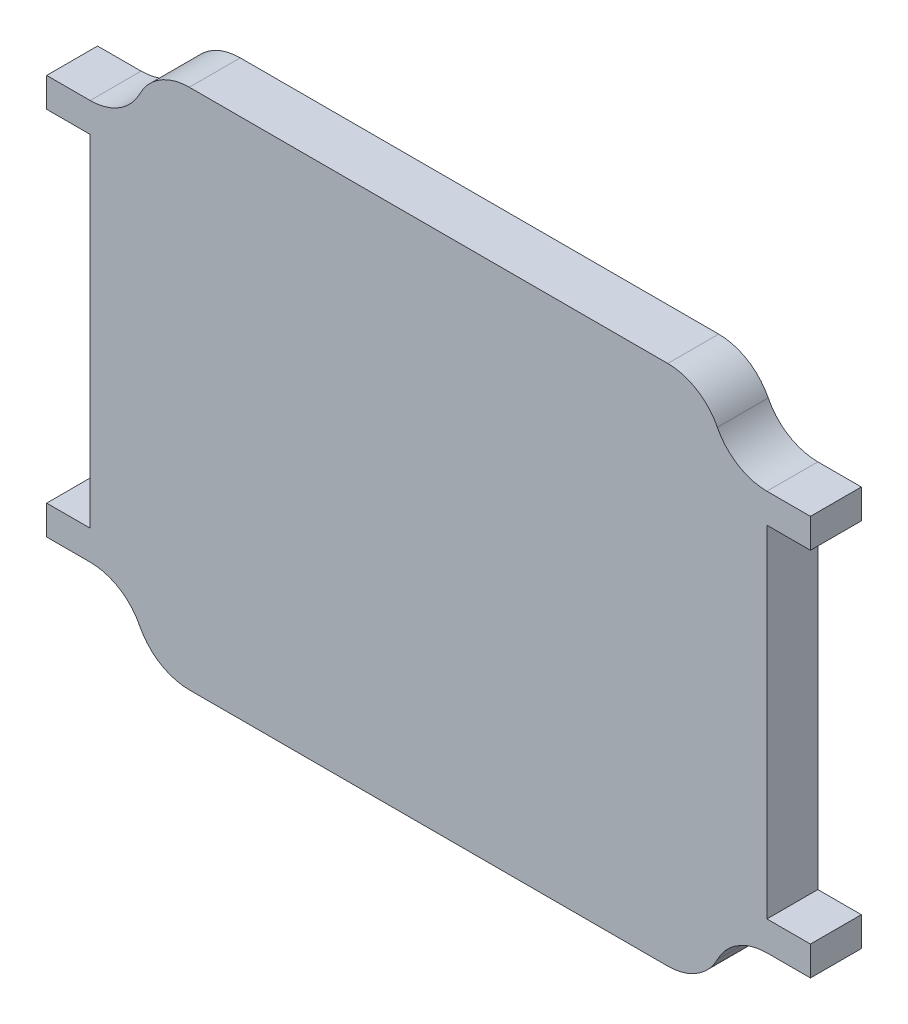
from build123d import *

# Parameters (mm, degrees)
BOSS_EXTRUDE1_DEPTH = 5.85


with BuildPart() as part:
    # Sketch1 → Boss-Extrude1 (new body)
    with BuildSketch(Plane.XY):
        with BuildLine():
            Line((-38.9, 19.6), (-38.9, -19.6))
            Line((-38.9, -19.6), (-43.9, -19.6))
            Line((-43.9, -19.6), (-43.9, -22.98))
            Line((-43.9, -22.98), (-38.9, -22.98))
            ThreePointArc((-38.9, -22.98), (-35.552982671, -23.927877842), (-33.2, -26.49))
            ThreePointArc((-33.2, -26.49), (-30.847017329, -29.052122158), (-27.5, -30))
            Line((-27.5, -30), (27.5, -30))
            ThreePointArc((27.5, -30), (30.847017329, -29.052122158), (33.2, -26.49))
            ThreePointArc((33.2, -26.49), (35.552982671, -23.927877842), (38.9, -22.98))
            Line((38.9, -22.98), (43.9, -22.98))
            Line((43.9, -22.98), (43.9, -19.6))
            Line((43.9, -19.6), (38.9, -19.6))
            Line((38.9, -19.6), (38.9, 19.6))
            Line((38.9, 19.6), (43.9, 19.6))
            Line((43.9, 19.6), (43.9, 22.98))
            Line((43.9, 22.98), (38.9, 22.98))
            ThreePointArc((38.9, 22.98), (35.552982671, 23.927877842), (33.2, 26.49))
            ThreePointArc((33.2, 26.49), (30.847017329, 29.052122158), (27.5, 30))
            Line((27.5, 30), (-27.5, 30))
            ThreePointArc((-27.5, 30), (-30.847017329, 29.052122158), (-33.2, 26.49))
            ThreePointArc((-33.2, 26.49), (-35.552982671, 23.927877842), (-38.9, 22.98))
            Line((-38.9, 22.98), (-43.9, 22.98))
            Line((-43.9, 22.98), (-43.9, 19.6))
            Line((-43.9, 19.6), (-38.9, 19.6))
        make_face()
    extrude(amount=BOSS_EXTRUDE1_DEPTH)


solid = part.part
